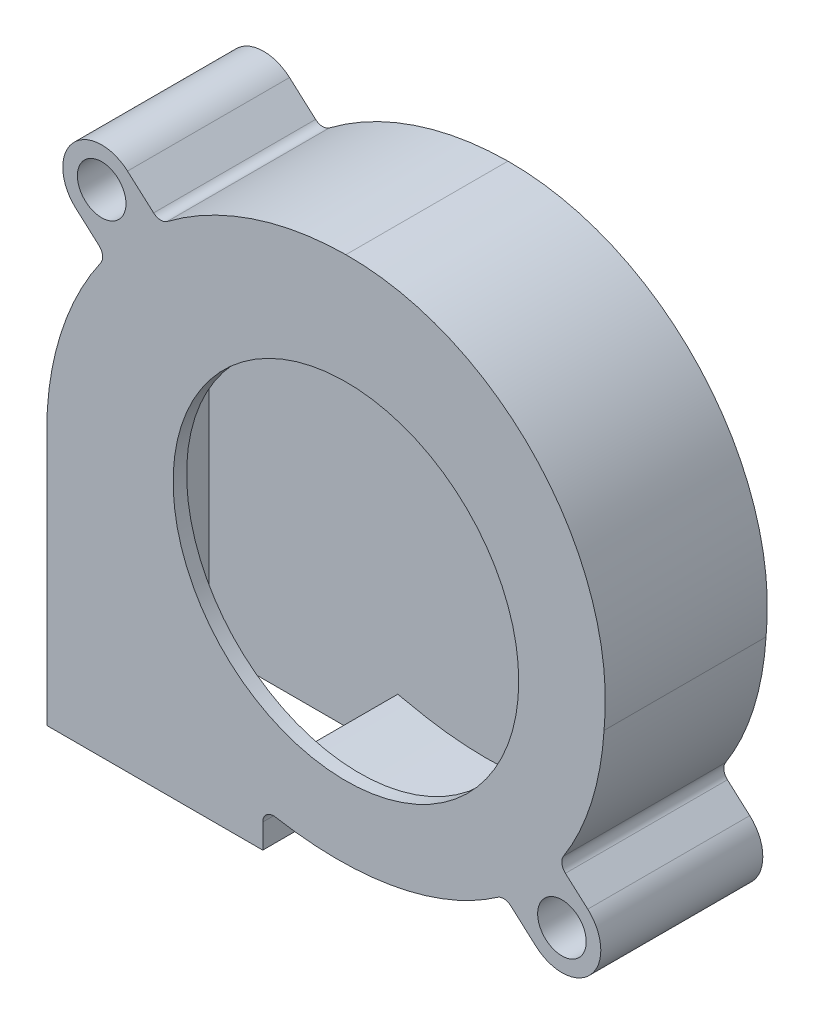
from build123d import *

# Parameters (mm, degrees)
SKETCH2_R           = 2.25
BOSS_EXTRUDE1_DEPTH = 15
SHELL1_START        = 1.25
SHELL1_DEPTH        = 12.5
CUT_EXTRUDE1_REACH  = 42.973
SKETCH3_R           = 16
FILLET1_R           = 1


# Read off the part's stored shape, not the designer's step: Shell1
with BuildPart() as part:
    # Sketch2 → Boss-Extrude1 (new body)
    with BuildSketch(Plane.XY):
        with BuildLine():
            Line((-27.7, -1.754714302), (-27.7, -25.4))
            Line((-27.7, -25.4), (-7.7, -25.4))
            Line((-7.7, -25.4), (-7.7, -21.934994614))
            add(Edge.make_bspline(
                [(-7.7, -21.934994614), (1.089505829, -23.776714198), (8.970252681, -22.10862964), (14.671105933, -17.856437337)],
                knots=[0, 0, 0, 0, 0.517783655, 0.517783655, 0.517783655, 0.517783655], degree=3))
            Line((14.671105933, -17.856437337), (17.608394445, -20.467156716))
            ThreePointArc((17.608394445, -20.467156716), (22.690766223, -20.167996048), (22.391605555, -15.085624269))
            Line((22.391605555, -15.085624269), (19.673138844, -12.669397979))
            add(Edge.make_bspline(
                [(19.673138844, -12.669397979), (22.084739228, -9.177460006), (23.581545529, -4.890349215), (23.9, 0)],
                knots=[0.693538152, 0.693538152, 0.693538152, 0.693538152, 1, 1, 1, 1], degree=3))
            ThreePointArc((23.9, 0), (17.803458828, 18.439605572), (0, 26.2))
            ThreePointArc((0, 26.2), (-9.105433904, 24.587214818), (-17.186614263, 20.092270255))
            Line((-17.186614263, 20.092270255), (-20.222659144, 22.790766223))
            ThreePointArc((-20.222659144, 22.790766223), (-25.305030923, 22.491605555), (-25.005870255, 17.409233777))
            Line((-25.005870255, 17.409233777), (-22.191609365, 14.907863751))
            ThreePointArc((-22.191609365, 14.907863751), (-26.28720334, 7.020020377), (-27.7, -1.754714302))
        make_face()
        with Locations((20, -17.776390493)):
            Circle(SKETCH2_R, mode=Mode.SUBTRACT)
        with Locations((-22.6142647, 20.1)):
            Circle(SKETCH2_R, mode=Mode.SUBTRACT)
    extrude(amount=BOSS_EXTRUDE1_DEPTH)

    # Shell1 outline → Shell1 (cut)
    with BuildSketch(Plane.XY.offset(SHELL1_START)):
        with BuildLine():
            Line((19.622532896, -14.296804513), (18.016150224, -12.869020231))
            add(Edge.make_bspline(
                [(18.016150224, -12.869020231), (18.051576945, -12.817723211), (18.087003667, -12.766426191), (18.122430388, -12.715129171), (18.157857109, -12.66383215), (18.193283831, -12.612535131), (18.228710551, -12.56123811), (18.264137274, -12.50994109), (18.299563994, -12.45864407), (18.334990716, -12.40734705), (18.370417437, -12.35605003), (18.405844159, -12.30475301), (18.44127088, -12.25345599), (18.476697601, -12.20215897), (18.520981003, -12.138037694), (18.529837683, -12.125213439), (18.538694363, -12.112389184), (18.547551044, -12.099564929), (18.556407724, -12.086740674), (18.565264404, -12.073916419), (18.574121085, -12.061092164), (18.582977765, -12.048267909), (18.591834446, -12.035443654), (18.600691126, -12.022619399), (18.609547806, -12.009795144), (18.618404486, -11.996970889), (18.627261167, -11.984146634), (18.636671389, -11.970520863), (18.637224932, -11.969719347), (18.637778474, -11.968917831), (18.638332017, -11.968116315), (18.638885559, -11.967314799), (18.639439102, -11.966513284), (18.639992644, -11.965711767), (18.640546187, -11.964910252), (18.64109973, -11.964108735), (18.641653272, -11.96330722), (18.642206815, -11.962505704), (18.642760357, -11.961704188), (18.6433139, -11.960902672), (18.643936635, -11.960000966), (18.644007721, -11.959898036), (18.644065014, -11.959815075), (18.644167659, -11.959666454), (18.644187428, -11.959637822), (18.644283855, -11.9594982), (18.644383013, -11.959354625), (18.644395371, -11.959336729), (18.644469199, -11.959229822), (18.644608909, -11.959027533), (18.644602592, -11.959036679), (18.644696049, -11.958901353), (18.644756897, -11.958813245), (18.644887565, -11.958624032), (18.644952899, -11.958529425), (18.645018233, -11.958434817), (18.645083566, -11.958340209), (18.645148897, -11.958245601), (18.64521423, -11.958150993), (18.64527956, -11.958056383), (18.645344892, -11.957961774), (18.645410222, -11.957867163), (18.645475552, -11.957772553), (18.645540881, -11.957677942), (18.64560621, -11.957583331), (18.645671538, -11.957488719), (18.645867521, -11.957204882), (18.645998175, -11.957015655), (18.646128827, -11.956826427), (18.646259476, -11.956637197), (18.646390124, -11.956447965), (18.646520768, -11.956258731), (18.646651413, -11.956069496), (18.646782053, -11.955880258), (18.646912693, -11.95569102), (18.64704333, -11.955501779), (18.647173965, -11.955312536), (18.647304598, -11.955123292), (18.64743523, -11.954934045), (18.647827117, -11.954366301), (18.648088368, -11.953987798), (18.64834961, -11.953609287), (18.648610844, -11.95323077), (18.648872069, -11.952852245), (18.649133288, -11.952473713), (18.649394497, -11.952095174), (18.649655699, -11.951716627), (18.649916892, -11.951338074), (18.650178078, -11.950959513), (18.650439255, -11.950580945), (18.650700424, -11.95020237), (18.650961585, -11.949823787), (18.65226735, -11.947930839), (18.653311833, -11.946416366), (18.654356185, -11.944901777), (18.655400408, -11.943387074), (18.656444501, -11.941872255), (18.657488465, -11.940357322), (18.658532298, -11.938842273), (18.659576002, -11.937327109), (18.660619576, -11.93581183), (18.661663021, -11.934296437), (18.662706335, -11.932780928), (18.66374952, -11.931265304), (18.664792575, -11.929749565), (18.667921351, -11.925202003), (18.670006683, -11.922169835), (18.672091495, -11.919137207), (18.674175788, -11.916104119), (18.676259561, -11.913070571), (18.678342816, -11.910036563), (18.680425551, -11.907002096), (18.682507767, -11.903967167), (18.684589463, -11.90093178), (18.68667064, -11.897895932), (18.688751296, -11.894859625), (18.690831434, -11.891822858), (18.692911052, -11.888785631), (18.699148345, -11.879672571), (18.703304462, -11.873595358), (18.7074585, -11.867516307), (18.711610458, -11.861435418), (18.715760335, -11.85535269), (18.719908132, -11.849268125), (18.724053848, -11.843181721), (18.728197483, -11.83709348), (18.732339035, -11.831003402), (18.736478506, -11.824911486), (18.740615894, -11.818817734), (18.744751199, -11.812722145), (18.748884421, -11.80662472), (18.769540109, -11.776128414), (18.786031319, -11.751701992), (18.802489161, -11.727246206), (18.818913609, -11.702761073), (18.835304639, -11.678246607), (18.851662221, -11.653702823), (18.867986333, -11.629129738), (18.884276945, -11.604527363), (18.900534033, -11.579895716), (18.91675757, -11.555234811), (18.932947531, -11.530544664), (18.949103888, -11.505825288), (18.965226617, -11.4810767), (19.04567198, -11.357187769), (19.10948985, -11.25760948), (19.172767579, -11.157564989), (19.235503448, -11.057055241), (19.297695737, -10.956081176), (19.359342728, -10.85464374), (19.420442701, -10.752743874), (19.480993936, -10.650382523), (19.540994714, -10.547560629), (19.600443315, -10.444279135), (19.659338021, -10.340538985), (19.717677112, -10.236341121), (19.775458869, -10.131686486), (19.947126977, -9.816355101), (20.059335888, -9.604310842), (20.16929426, -9.390450666), (20.276987945, -9.174781998), (20.382402688, -8.957312267), (20.485524131, -8.738048908), (20.586337811, -8.516999358), (20.684829159, -8.294171063), (20.780983502, -8.06957147), (20.874786063, -7.843208033), (20.966221959, -7.61508821), (21.055276202, -7.385219464), (21.1419337, -7.153609263), (21.310424813, -6.686920896), (21.392258464, -6.45184282), (21.471664997, -6.215038335), (21.548629109, -5.976514973), (21.623135411, -5.736280308), (21.695168429, -5.494341964), (21.764712594, -5.250707611), (21.831752262, -5.005384963), (21.896271688, -4.758381783), (21.958255052, -4.50970588), (22.017686437, -4.259365107), (22.074549845, -4.007367366), (22.128829187, -3.753720604), (22.20634784, -3.370788921), (22.231537383, -3.242734734), (22.256074879, -3.114271279), (22.279958285, -2.985399584), (22.30318556, -2.856120672), (22.325754665, -2.726435571), (22.347663554, -2.596345306), (22.368910193, -2.465850903), (22.389492535, -2.334953386), (22.409408542, -2.203653784), (22.428656171, -2.07195312), (22.447233383, -1.939852421), (22.465138135, -1.807352712), (22.490983513, -1.608006173), (22.499430005, -1.54145784), (22.507707606, -1.474810151), (22.515816054, -1.408063241), (22.523755093, -1.341217241), (22.531524462, -1.274272285), (22.539123905, -1.207228504), (22.546553159, -1.140086033), (22.553811969, -1.072845002), (22.560900073, -1.005505546), (22.567817215, -0.938067797), (22.574563135, -0.870531887), (22.581137573, -0.80289795), (22.590741621, -0.701300201), (22.593900035, -0.667409811), (22.597015481, -0.633494965), (22.600087926, -0.59955568), (22.603117338, -0.565591972), (22.606103685, -0.531603859), (22.609046934, -0.497591356), (22.611947051, -0.463554482), (22.614804006, -0.429493253), (22.617617765, -0.395407686), (22.620388296, -0.361297797), (22.623115565, -0.327163604), (22.625799541, -0.293005124), (22.629760517, -0.241730997), (22.63107001, -0.224633554), (22.632368668, -0.207530045), (22.633656487, -0.190420473), (22.63493346, -0.17330484), (22.636199589, -0.156183147), (22.637454861, -0.139055398), (22.638699282, -0.121921594), (22.639932839, -0.104781737), (22.641155535, -0.087635829), (22.64236736, -0.070483873), (22.643568315, -0.053325871), (22.644758392, -0.036161825), (22.646232388, -0.014699214), (22.646526508, -0.010406314), (22.646819947, -0.006113037), (22.647112705, -0.001819382), (22.647404785, 0.00247465), (22.647696182, 0.00676906), (22.647986902, 0.011063848), (22.648276938, 0.015359013), (22.648566297, 0.019654555), (22.648854972, 0.023950474), (22.649142969, 0.028246771), (22.649430284, 0.032543446), (22.649716919, 0.036840497), (22.65014585, 0.04328664), (22.650288657, 0.045435449), (22.650431293, 0.047584352), (22.65057376, 0.049733349), (22.650716055, 0.051882441), (22.650858182, 0.054031626), (22.651000137, 0.056180907), (22.651141923, 0.058330281), (22.651283537, 0.06047975), (22.651424983, 0.062629313), (22.651566257, 0.06477897), (22.651707361, 0.066928721), (22.651848295, 0.069078567), (22.65202425, 0.071765992), (22.65205943, 0.072303483), (22.6520946, 0.07284098), (22.652129759, 0.073378482), (22.652164908, 0.073915991), (22.652200045, 0.074453505), (22.652235173, 0.074991026), (22.652270288, 0.075528552), (22.652305395, 0.076066084), (22.652340489, 0.076603622), (22.652375574, 0.077141166), (22.652410648, 0.077678716), (22.652445711, 0.078216272), (22.652489527, 0.078888224), (22.652498289, 0.079022614), (22.652507051, 0.079157006), (22.652515812, 0.079291397), (22.652524573, 0.079425789), (22.652533332, 0.079560181), (22.652542092, 0.079694574), (22.65255085, 0.079828967), (22.652559608, 0.07996336), (22.652568365, 0.080097754), (22.652577122, 0.080232148), (22.652585877, 0.080366542), (22.652594633, 0.080500937), (22.652612142, 0.080769727), (22.652621626, 0.080915337), (22.652624364, 0.080957354), (22.652656726, 0.081454433), (22.652609826, 0.080733725), (22.652702072, 0.08215146), (22.652629159, 0.081030098), (22.652694632, 0.082037175), (22.652676876, 0.081763348), (22.65269448, 0.082034275), (22.652702142, 0.082151727), (22.652711317, 0.082292672), (22.652720479, 0.08243336), (22.65274789, 0.082854297), (22.652766164, 0.083134921), (22.652784438, 0.083415546), (22.652802712, 0.08369617), (22.652820985, 0.083976794), (22.652839261, 0.084257419), (22.652857533, 0.084538043), (22.652875809, 0.084818668), (22.652894081, 0.085099292), (22.652912356, 0.085379917), (22.652930629, 0.085660541), (22.652948904, 0.085941166), (22.652967178, 0.08622179), (22.653058548, 0.087624912), (22.653131643, 0.08874741), (22.653204739, 0.089869908), (22.653277835, 0.090992406), (22.653350932, 0.092114904), (22.653424026, 0.093237402), (22.653497124, 0.094359899), (22.653570218, 0.095482397), (22.653643315, 0.096604895), (22.65371641, 0.097727393), (22.653789507, 0.098849891), (22.653862602, 0.099972389), (22.653935698, 0.101094887), (22.654016655, 0.102338098), (22.654024516, 0.102458811), (22.654032376, 0.102579524), (22.654040237, 0.102700237), (22.654048098, 0.10282095), (22.654055958, 0.102941663), (22.654063819, 0.103062376), (22.65407168, 0.103183089), (22.654079541, 0.103303803), (22.654087401, 0.103424516), (22.654095262, 0.103545229), (22.654103123, 0.103665942), (22.654110983, 0.103786655), (22.654118844, 0.103907368)],
                knots=[0.666917962, 0.666917962, 0.666917962, 0.666917962, 0.666917962, 0.666917962, 0.666917962, 0.666917962, 0.666917962, 0.666917962, 0.666917962, 0.666917962, 0.666917962, 0.666917962, 0.666917962, 0.687927128, 0.687927128, 0.687927128, 0.687927128, 0.687927128, 0.687927128, 0.687927128, 0.687927128, 0.687927128, 0.687927128, 0.687927128, 0.687927128, 0.687927128, 0.693179419, 0.693179419, 0.693179419, 0.693179419, 0.693179419, 0.693179419, 0.693179419, 0.693179419, 0.693179419, 0.693179419, 0.693179419, 0.693179419, 0.693179419, 0.693507688, 0.693507688, 0.693507688, 0.693507688, 0.693507688, 0.693507688, 0.693507688, 0.693507688, 0.693507688, 0.693507688, 0.693507688, 0.693507688, 0.693507688, 0.693548721, 0.693548721, 0.693548721, 0.693548721, 0.693548721, 0.693548721, 0.693548721, 0.693548721, 0.693548721, 0.693548721, 0.693548721, 0.693548721, 0.693548721, 0.693589755, 0.693589755, 0.693589755, 0.693589755, 0.693589755, 0.693589755, 0.693589755, 0.693589755, 0.693589755, 0.693589755, 0.693589755, 0.693589755, 0.693589755, 0.693671822, 0.693671822, 0.693671822, 0.693671822, 0.693671822, 0.693671822, 0.693671822, 0.693671822, 0.693671822, 0.693671822, 0.693671822, 0.693671822, 0.693671822, 0.693835956, 0.693835956, 0.693835956, 0.693835956, 0.693835956, 0.693835956, 0.693835956, 0.693835956, 0.693835956, 0.693835956, 0.693835956, 0.693835956, 0.693835956, 0.694492492, 0.694492492, 0.694492492, 0.694492492, 0.694492492, 0.694492492, 0.694492492, 0.694492492, 0.694492492, 0.694492492, 0.694492492, 0.694492492, 0.694492492, 0.695805565, 0.695805565, 0.695805565, 0.695805565, 0.695805565, 0.695805565, 0.695805565, 0.695805565, 0.695805565, 0.695805565, 0.695805565, 0.695805565, 0.695805565, 0.698431711, 0.698431711, 0.698431711, 0.698431711, 0.698431711, 0.698431711, 0.698431711, 0.698431711, 0.698431711, 0.698431711, 0.698431711, 0.698431711, 0.698431711, 0.708936294, 0.708936294, 0.708936294, 0.708936294, 0.708936294, 0.708936294, 0.708936294, 0.708936294, 0.708936294, 0.708936294, 0.708936294, 0.708936294, 0.708936294, 0.750954626, 0.750954626, 0.750954626, 0.750954626, 0.750954626, 0.750954626, 0.750954626, 0.750954626, 0.750954626, 0.750954626, 0.750954626, 0.750954626, 0.750954626, 0.83499129, 0.83499129, 0.83499129, 0.83499129, 0.83499129, 0.83499129, 0.83499129, 0.83499129, 0.83499129, 0.83499129, 0.83499129, 0.83499129, 0.83499129, 0.919027954, 0.919027954, 0.919027954, 0.919027954, 0.919027954, 0.919027954, 0.919027954, 0.919027954, 0.919027954, 0.919027954, 0.919027954, 0.919027954, 0.919027954, 0.961046286, 0.961046286, 0.961046286, 0.961046286, 0.961046286, 0.961046286, 0.961046286, 0.961046286, 0.961046286, 0.961046286, 0.961046286, 0.961046286, 0.961046286, 0.982055452, 0.982055452, 0.982055452, 0.982055452, 0.982055452, 0.982055452, 0.982055452, 0.982055452, 0.982055452, 0.982055452, 0.982055452, 0.982055452, 0.982055452, 0.992560035, 0.992560035, 0.992560035, 0.992560035, 0.992560035, 0.992560035, 0.992560035, 0.992560035, 0.992560035, 0.992560035, 0.992560035, 0.992560035, 0.992560035, 0.997812327, 0.997812327, 0.997812327, 0.997812327, 0.997812327, 0.997812327, 0.997812327, 0.997812327, 0.997812327, 0.997812327, 0.997812327, 0.997812327, 0.997812327, 0.9991254, 0.9991254, 0.9991254, 0.9991254, 0.9991254, 0.9991254, 0.9991254, 0.9991254, 0.9991254, 0.9991254, 0.9991254, 0.9991254, 0.9991254, 0.999781936, 0.999781936, 0.999781936, 0.999781936, 0.999781936, 0.999781936, 0.999781936, 0.999781936, 0.999781936, 0.999781936, 0.999781936, 0.999781936, 0.999781936, 0.99994607, 0.99994607, 0.99994607, 0.99994607, 0.99994607, 0.99994607, 0.99994607, 0.99994607, 0.99994607, 0.99994607, 0.99994607, 0.99994607, 0.99994607, 0.999987104, 0.999987104, 0.999987104, 0.999987104, 0.999987104, 0.999987104, 0.999987104, 0.999987104, 0.999987104, 0.999987104, 0.999987104, 0.999987104, 0.999987104, 1.000028137, 1.000028137, 1.000028137, 1.000028137, 1.000028137, 1.000028137, 1.000028137, 1.000028137, 1.000028137, 1.000028137, 1.000028137, 1.000028137, 1.000028137, 1.000110205, 1.000110205, 1.000110205, 1.000110205, 1.000110205, 1.000110205, 1.000110205, 1.000110205, 1.000110205, 1.000110205, 1.000110205, 1.000110205, 1.000110205, 1.000438473, 1.000438473, 1.000438473, 1.000438473, 1.000438473, 1.000438473, 1.000438473, 1.000438473, 1.000438473, 1.000438473, 1.000438473, 1.000438473, 1.000438473, 1.000473775, 1.000473775, 1.000473775, 1.000473775, 1.000473775, 1.000473775, 1.000473775, 1.000473775, 1.000473775, 1.000473775, 1.000473775, 1.000473775, 1.000473775, 1.000473775, 1.000473775], degree=14))
            ThreePointArc((22.654118844, 0.103907368), (16.887423541, 17.589012543), (0.011441482, 24.950052364))
            ThreePointArc((0.011441482, 24.950052364), (-9.179774467, 23.228732983), (-17.214144884, 18.44435392))
            Line((-17.214144884, 18.44435392), (-19.114423676, 20.133358812))
            ThreePointArc((-19.114423676, 20.133358812), (-19.998241983, 17.774827932), (-22.236797596, 16.620414021))
            Line((-22.236797596, 16.620414021), (-20.48740424, 15.06551905))
            ThreePointArc((-20.48740424, 15.06551905), (-24.915251155, 7.168188788), (-26.45, -1.754714302))
            Line((-26.45, -1.754714302), (-26.45, -25.4))
            Line((-26.45, -25.4), (-8.95, -25.4))
            Line((-8.95, -25.4), (-8.95, -20.395928254))
            add(Edge.make_bspline(
                [(-8.95, -20.395928254), (-8.879967103, -20.41060268), (-8.809934206, -20.425277107), (-8.739901309, -20.439951533), (-8.669868412, -20.45462596), (-8.599835515, -20.469300386), (-8.529802618, -20.483974813), (-8.459769721, -20.498649239), (-8.389736824, -20.513323666), (-8.319703927, -20.527998093), (-8.24967103, -20.542672519), (-8.179638133, -20.557346946), (-8.109605236, -20.572021373), (-8.00455589, -20.594033012), (-7.969539442, -20.601370226), (-7.934522993, -20.608707439), (-7.899506544, -20.616044652), (-7.864490096, -20.623381866), (-7.829473647, -20.630719079), (-7.794457199, -20.638056292), (-7.75944075, -20.645393505), (-7.724424302, -20.652730719), (-7.689407853, -20.660067932), (-7.654391405, -20.667405145), (-7.619374956, -20.674742359), (-7.575604396, -20.683913875), (-7.566850284, -20.685748179), (-7.558096171, -20.687582482), (-7.549342059, -20.689416785), (-7.540587947, -20.691251089), (-7.531833835, -20.693085392), (-7.523079723, -20.694919695), (-7.514325611, -20.696753999), (-7.505571499, -20.698588302), (-7.496817387, -20.700422605), (-7.488063274, -20.702256908), (-7.479309162, -20.704091212), (-7.469460786, -20.706154803), (-7.468366522, -20.706384091), (-7.467272258, -20.706613379), (-7.466177994, -20.706842667), (-7.46508373, -20.707071955), (-7.463989466, -20.707301243), (-7.462895202, -20.707530531), (-7.461800938, -20.707759818), (-7.460706674, -20.707989106), (-7.45961241, -20.708218394), (-7.458518146, -20.708447682), (-7.457423882, -20.70867697), (-7.455782486, -20.709020902), (-7.455235354, -20.709135546), (-7.454688222, -20.70925019), (-7.45414109, -20.709364834), (-7.453593958, -20.709479478), (-7.453046826, -20.709594122), (-7.452499694, -20.709708766), (-7.451952562, -20.70982341), (-7.45140543, -20.709938054), (-7.450858298, -20.710052698), (-7.450311166, -20.710167342), (-7.449764034, -20.710281986), (-7.448943336, -20.710453951), (-7.44866977, -20.710511273), (-7.448396204, -20.710568595), (-7.448122638, -20.710625917), (-7.447849072, -20.710683239), (-7.447575506, -20.710740561), (-7.44730194, -20.710797883), (-7.447028374, -20.710855205), (-7.446754808, -20.710912527), (-7.446481242, -20.710969849), (-7.446207676, -20.711027171), (-7.44593411, -20.711084493), (-7.445523761, -20.711170476), (-7.445386978, -20.711199137), (-7.445250195, -20.711227798), (-7.445113412, -20.711256459), (-7.444976629, -20.71128512), (-7.444839846, -20.711313781), (-7.444703063, -20.711342442), (-7.44456628, -20.711371103), (-7.444429497, -20.711399764), (-7.444292714, -20.711428425), (-7.444155931, -20.711457086), (-7.444019148, -20.711485747), (-7.443745582, -20.711543069), (-7.443605589, -20.711572403), (-7.443475817, -20.711599595), (-7.443347829, -20.711626412), (-7.443215786, -20.711654079), (-7.44308089, -20.711682342), (-7.442947139, -20.711710365), (-7.442816245, -20.711737789), (-7.44268608, -20.71176506), (-7.442553546, -20.711792827), (-7.44241929, -20.711820953), (-7.442288176, -20.711848421), (-7.440040957, -20.712319196), (-7.437925972, -20.712762124), (-7.43581103, -20.713204901), (-7.433696133, -20.713647524), (-7.431581279, -20.714089994), (-7.42946647, -20.714532312), (-7.427351704, -20.714974476), (-7.425236983, -20.715416488), (-7.423122306, -20.715858347), (-7.421007673, -20.716300053), (-7.418893084, -20.716741607), (-7.41677854, -20.717183007), (-7.410435038, -20.71850675), (-7.406206213, -20.719388634), (-7.401977564, -20.720269907), (-7.397749093, -20.721150569), (-7.393520797, -20.722030619), (-7.389292679, -20.722910059), (-7.385064737, -20.723788887), (-7.380836972, -20.724667105), (-7.376609384, -20.725544711), (-7.372381972, -20.726421706), (-7.368154737, -20.727298091), (-7.36392768, -20.728173864), (-7.342793275, -20.732549677), (-7.325888583, -20.736040554), (-7.308986725, -20.739521659), (-7.292087703, -20.742992996), (-7.27519152, -20.746454565), (-7.25829818, -20.749906371), (-7.241407684, -20.753348414), (-7.224520036, -20.756780698), (-7.207635238, -20.760203225), (-7.190753293, -20.763615997), (-7.173874204, -20.767019017), (-7.156997974, -20.770412287), (-7.005137653, -20.800863985), (-6.870333839, -20.827308309), (-6.735714564, -20.853129997), (-6.601281224, -20.878330267), (-6.467035219, -20.902910335), (-6.332977948, -20.926871418), (-6.199110809, -20.950214732), (-6.065435201, -20.972941495), (-5.931952523, -20.995052923), (-5.798664173, -21.016550234), (-5.665571549, -21.037434643), (-5.532676052, -21.057707367), (-5.134585132, -21.116694138), (-4.869985217, -21.153576784), (-4.606190462, -21.188027311), (-4.343211966, -21.220055469), (-4.081060795, -21.249671005), (-3.819747989, -21.27688367), (-3.559284555, -21.301703209), (-3.299681472, -21.324139372), (-3.040949689, -21.344201906), (-2.783100124, -21.361900558), (-2.526143667, -21.377245074), (-2.270091177, -21.390245202), (-1.504678093, -21.422241656), (-0.998061782, -21.434233714), (-0.495191246, -21.43696511), (0.003847391, -21.430513869), (0.498968576, -21.414957797), (0.990087332, -21.390374479), (1.477119251, -21.356841278), (1.959980499, -21.314435339), (2.438587816, -21.263233582), (2.912858513, -21.203312709), (3.382710474, -21.134749199), (3.848062156, -21.057619313), (4.769603018, -20.886378864), (5.225792085, -20.792267507), (5.67731905, -20.689741164), (6.124103702, -20.578875315), (6.566066349, -20.459744782), (7.003127825, -20.332423722), (7.435209485, -20.19698563), (7.862233207, -20.053503339), (8.28412139, -19.90204902), (8.70079696, -19.74269418), (9.112183361, -19.575509665), (9.518204562, -19.400565658), (10.119075303, -19.12661469), (10.318005296, -19.033375084), (10.51556558, -18.938221503), (10.711746711, -18.841162523), (10.906539263, -18.742206662), (11.099933819, -18.64136237), (11.29192098, -18.538638038), (11.482491359, -18.434041992), (11.671635584, -18.327582497), (11.859344295, -18.219267753), (12.04560815, -18.1091059), (12.230417816, -17.997105011), (12.505437058, -17.826357147), (12.596744258, -17.768983474), (12.687684411, -17.711153061), (12.778256351, -17.652866887), (12.868458909, -17.594125932), (12.95829092, -17.534931172), (13.047751217, -17.47528359), (13.136838631, -17.41518416), (13.225551998, -17.354633864), (13.313890149, -17.293633679), (13.401851919, -17.232184585), (13.489436139, -17.17028756), (13.59844302, -17.09235759), (13.620220726, -17.076743658), (13.641974744, -17.061101806), (13.663705056, -17.045432045), (13.685411644, -17.029734393), (13.707094488, -17.014008863), (13.728753571, -16.998255471), (13.750388875, -16.982474231), (13.772000381, -16.966665159), (13.793588071, -16.950828268), (13.815151927, -16.934963575), (13.836691931, -16.919071093), (13.86089758, -16.901160806), (13.863586724, -16.89917034), (13.866275494, -16.89717944), (13.868963892, -16.895188106), (13.871651916, -16.893196339), (13.874339568, -16.891204137), (13.877026846, -16.889211502), (13.879713751, -16.887218433), (13.882400283, -16.88522493), (13.885086441, -16.883230994), (13.887772226, -16.881236624), (13.890457638, -16.87924182), (13.894485196, -16.876248964), (13.895827622, -16.875251236), (13.897169954, -16.874253401), (13.898512194, -16.873255457), (13.899854339, -16.872257405), (13.901196392, -16.871259244), (13.902538351, -16.870260975), (13.903880217, -16.869262597), (13.905221989, -16.868264111), (13.906563668, -16.867265517), (13.907905254, -16.866266814), (13.909246746, -16.865268003), (13.911258844, -16.863769624), (13.91192952, -16.863270137), (13.912600173, -16.862770623), (13.913270802, -16.862271082), (13.913941408, -16.861771514), (13.914611991, -16.861271919), (13.91528255, -16.860772297), (13.915953086, -16.860272647), (13.916623599, -16.859772971), (13.917294088, -16.859273267), (13.917964554, -16.858773537), (13.918634997, -16.858273779), (13.919640625, -16.857524102), (13.919975829, -16.857274202), (13.920311027, -16.857024297), (13.920646219, -16.856774384), (13.920981405, -16.856524464), (13.921316586, -16.856274538), (13.92165176, -16.856024605), (13.921986929, -16.855774665), (13.922322092, -16.855524719), (13.922657249, -16.855274765), (13.9229924, -16.855024805), (13.923327546, -16.854774838), (13.923830255, -16.854399878), (13.923992275, -16.854279026), (13.924297546, -16.854051334), (13.92410082, -16.854198063), (13.924981362, -16.853541283), (13.924212736, -16.85411459), (13.925334235, -16.853278077), (13.924808534, -16.853670192), (13.925371285, -16.853250442), (13.925399495, -16.853229401), (13.925614179, -16.853069271), (13.925786988, -16.852940375), (13.926141857, -16.852675683), (13.926319291, -16.852543337), (13.926496725, -16.852410991), (13.92667416, -16.852278645), (13.926851594, -16.852146299), (13.927029028, -16.852013954), (13.927206462, -16.851881608), (13.927383897, -16.851749262), (13.927561331, -16.851616916), (13.927738765, -16.85148457), (13.9279162, -16.851352224), (13.928093634, -16.851219878), (13.933948965, -16.846852463), (13.939626862, -16.842617393), (13.945304759, -16.838382324), (13.950982656, -16.834147254), (13.956660553, -16.829912185), (13.96233845, -16.825677115), (13.968016347, -16.821442046), (13.973694244, -16.817206976), (13.979372141, -16.812971907), (13.985050038, -16.808736837), (13.990727935, -16.804501767), (13.996405832, -16.800266698), (14.013439523, -16.787561489), (14.024795317, -16.77909135), (14.036151111, -16.770621211), (14.047506905, -16.762151072), (14.058862699, -16.753680933), (14.070218493, -16.745210794), (14.081574286, -16.736740655), (14.092930081, -16.728270516), (14.104285874, -16.719800377), (14.115641668, -16.711330238), (14.126997462, -16.702860099), (14.138353256, -16.69438996), (14.195132226, -16.652039265), (14.240555402, -16.618158709), (14.285978578, -16.584278152), (14.331401754, -16.550397596), (14.37682493, -16.51651704), (14.422248105, -16.482636484), (14.467671281, -16.448755928), (14.513094457, -16.414875372), (14.558517633, -16.380994816), (14.603940809, -16.347114259), (14.649363985, -16.313233703), (14.69478716, -16.279353147), (14.740210336, -16.245472591)],
                knots=[-0.029579402, -0.029579402, -0.029579402, -0.029579402, -0.029579402, -0.029579402, -0.029579402, -0.029579402, -0.029579402, -0.029579402, -0.029579402, -0.029579402, -0.029579402, -0.029579402, -0.01170185, -0.01170185, -0.01170185, -0.01170185, -0.01170185, -0.01170185, -0.01170185, -0.01170185, -0.01170185, -0.01170185, -0.01170185, -0.01170185, -0.002763073, -0.002763073, -0.002763073, -0.002763073, -0.002763073, -0.002763073, -0.002763073, -0.002763073, -0.002763073, -0.002763073, -0.002763073, -0.002763073, -0.000528379, -0.000528379, -0.000528379, -0.000528379, -0.000528379, -0.000528379, -0.000528379, -0.000528379, -0.000528379, -0.000528379, -0.000528379, -0.000528379, -0.000249042, -0.000249042, -0.000249042, -0.000249042, -0.000249042, -0.000249042, -0.000249042, -0.000249042, -0.000249042, -0.000249042, -0.000249042, -0.000249042, -0.000109374, -0.000109374, -0.000109374, -0.000109374, -0.000109374, -0.000109374, -0.000109374, -0.000109374, -0.000109374, -0.000109374, -0.000109374, -0.000109374, -3.954e-05, -3.954e-05, -3.954e-05, -3.954e-05, -3.954e-05, -3.954e-05, -3.954e-05, -3.954e-05, -3.954e-05, -3.954e-05, -3.954e-05, -3.954e-05, -4.623e-06, -4.623e-06, -4.623e-06, -4.623e-06, -4.623e-06, -4.623e-06, -4.623e-06, -4.623e-06, -4.623e-06, -4.623e-06, -4.623e-06, -4.623e-06, 3.0294e-05, 3.0294e-05, 3.0294e-05, 3.0294e-05, 3.0294e-05, 3.0294e-05, 3.0294e-05, 3.0294e-05, 3.0294e-05, 3.0294e-05, 3.0294e-05, 3.0294e-05, 0.000588968, 0.000588968, 0.000588968, 0.000588968, 0.000588968, 0.000588968, 0.000588968, 0.000588968, 0.000588968, 0.000588968, 0.000588968, 0.000588968, 0.001706315, 0.001706315, 0.001706315, 0.001706315, 0.001706315, 0.001706315, 0.001706315, 0.001706315, 0.001706315, 0.001706315, 0.001706315, 0.001706315, 0.006175703, 0.006175703, 0.006175703, 0.006175703, 0.006175703, 0.006175703, 0.006175703, 0.006175703, 0.006175703, 0.006175703, 0.006175703, 0.006175703, 0.041930809, 0.041930809, 0.041930809, 0.041930809, 0.041930809, 0.041930809, 0.041930809, 0.041930809, 0.041930809, 0.041930809, 0.041930809, 0.041930809, 0.11344102, 0.11344102, 0.11344102, 0.11344102, 0.11344102, 0.11344102, 0.11344102, 0.11344102, 0.11344102, 0.11344102, 0.11344102, 0.11344102, 0.256461442, 0.256461442, 0.256461442, 0.256461442, 0.256461442, 0.256461442, 0.256461442, 0.256461442, 0.256461442, 0.256461442, 0.256461442, 0.256461442, 0.399481864, 0.399481864, 0.399481864, 0.399481864, 0.399481864, 0.399481864, 0.399481864, 0.399481864, 0.399481864, 0.399481864, 0.399481864, 0.399481864, 0.470992075, 0.470992075, 0.470992075, 0.470992075, 0.470992075, 0.470992075, 0.470992075, 0.470992075, 0.470992075, 0.470992075, 0.470992075, 0.470992075, 0.50674718, 0.50674718, 0.50674718, 0.50674718, 0.50674718, 0.50674718, 0.50674718, 0.50674718, 0.50674718, 0.50674718, 0.50674718, 0.50674718, 0.515685957, 0.515685957, 0.515685957, 0.515685957, 0.515685957, 0.515685957, 0.515685957, 0.515685957, 0.515685957, 0.515685957, 0.515685957, 0.515685957, 0.516803304, 0.516803304, 0.516803304, 0.516803304, 0.516803304, 0.516803304, 0.516803304, 0.516803304, 0.516803304, 0.516803304, 0.516803304, 0.516803304, 0.517361977, 0.517361977, 0.517361977, 0.517361977, 0.517361977, 0.517361977, 0.517361977, 0.517361977, 0.517361977, 0.517361977, 0.517361977, 0.517361977, 0.517641314, 0.517641314, 0.517641314, 0.517641314, 0.517641314, 0.517641314, 0.517641314, 0.517641314, 0.517641314, 0.517641314, 0.517641314, 0.517641314, 0.517780983, 0.517780983, 0.517780983, 0.517780983, 0.517780983, 0.517780983, 0.517780983, 0.517780983, 0.517780983, 0.517780983, 0.517780983, 0.517780983, 0.517850817, 0.517850817, 0.517850817, 0.517850817, 0.517850817, 0.517850817, 0.517850817, 0.517850817, 0.517850817, 0.517850817, 0.517850817, 0.517850817, 0.517920651, 0.517920651, 0.517920651, 0.517920651, 0.517920651, 0.517920651, 0.517920651, 0.517920651, 0.517920651, 0.517920651, 0.517920651, 0.517920651, 0.520155345, 0.520155345, 0.520155345, 0.520155345, 0.520155345, 0.520155345, 0.520155345, 0.520155345, 0.520155345, 0.520155345, 0.520155345, 0.520155345, 0.524624733, 0.524624733, 0.524624733, 0.524624733, 0.524624733, 0.524624733, 0.524624733, 0.524624733, 0.524624733, 0.524624733, 0.524624733, 0.524624733, 0.542502286, 0.542502286, 0.542502286, 0.542502286, 0.542502286, 0.542502286, 0.542502286, 0.542502286, 0.542502286, 0.542502286, 0.542502286, 0.542502286, 0.542502286, 0.542502286], degree=13))
            Line((14.740210336, -16.245472591), (16.500158977, -17.809749305))
            ThreePointArc((16.500158977, -17.809749305), (17.383977283, -15.451218425), (19.622532896, -14.296804513))
        make_face()
    extrude(amount=SHELL1_DEPTH, mode=Mode.SUBTRACT)

    # Sketch3 → Cut-Extrude1 (cut, up to next)
    with BuildSketch(Plane.XY.offset(15), mode=Mode.PRIVATE) as cut_extrude1_sk1:
        Circle(SKETCH3_R)
    cut_extrude1_tool1 = extrude(cut_extrude1_sk1.sketch, amount=-CUT_EXTRUDE1_REACH, mode=Mode.PRIVATE) & part.part
    add(cut_extrude1_tool1.solids().sort_by_distance((0, 0, 15))[0], mode=Mode.SUBTRACT)

    # Fillet1
    fillet1_edges = [part.edges().sort_by_distance(p)[0] for p in [
        (-22.191609365, 14.907863751, 7.5),
        (-17.186614263, 20.092270255, 7.5),
        (19.673138844, -12.669397979, 7.5),
        (14.671105933, -17.856437337, 7.5),
        (-7.7, -21.934994614, 7.5),
    ]]
    fillet(fillet1_edges, radius=FILLET1_R)


solid = part.part
